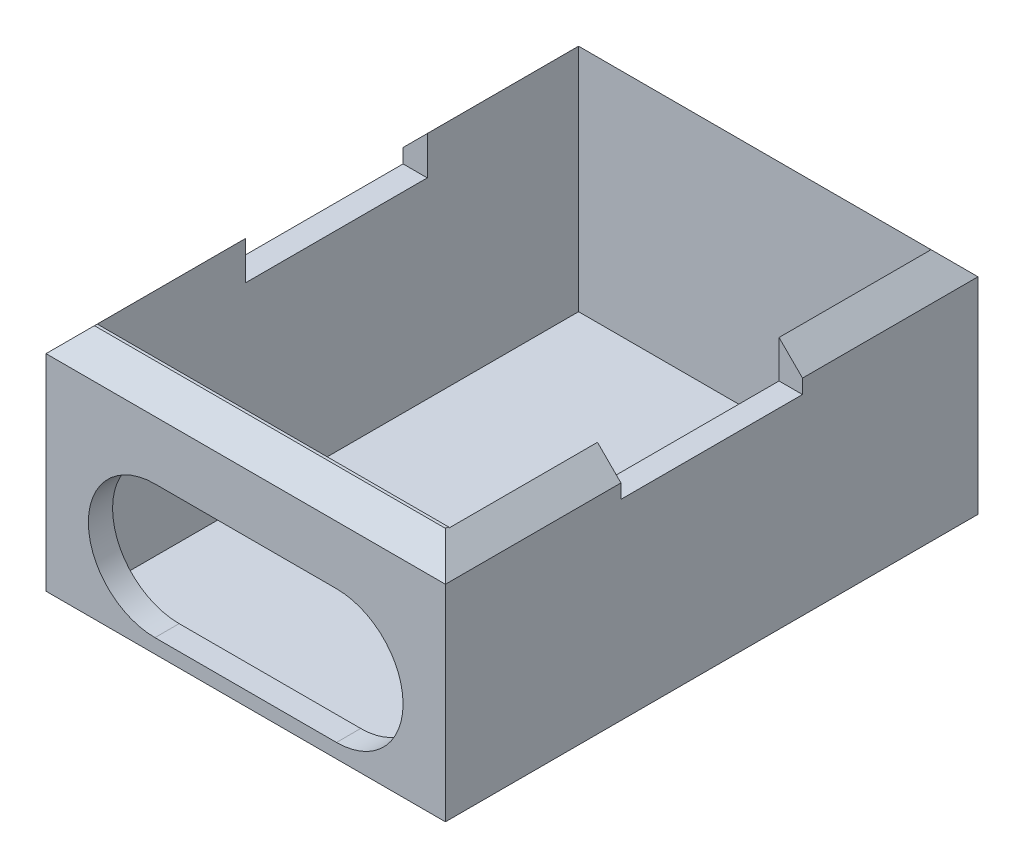
from build123d import *

# Parameters (mm, degrees)
SKETCH1_W           = 33
SKETCH1_H           = 44
BOSS_EXTRUDE1_DEPTH = 21
SHELL1_START        = 2
SHELL1_OUTLINE_W    = 17
SHELL1_OUTLINE_H    = 40
SHELL1_DEPTH        = 29
SKETCH2_W           = 29.062005015
SKETCH2_H           = 39.767253615
CUT_EXTRUDE1_DEPTH  = 7
CUT_EXTRUDE2_DEPTH  = 7
SKETCH4_W           = 15
SKETCH4_H           = 3.175
CUT_EXTRUDE3_DEPTH  = 45
CHAMFER1_SIZE       = 2


# Read off the part's stored shape, not the designer's step: Shell1
with BuildPart() as part:
    # Sketch1 → Boss-Extrude1 (new body)
    with BuildSketch(Plane(origin=(0, 0, 0), x_dir=(1, 0, 0), z_dir=(0, 1, 0))):
        with Locations((16.5, -12.899591929)):
            Rectangle(SKETCH1_W, SKETCH1_H)
    extrude(amount=BOSS_EXTRUDE1_DEPTH)

    # Shell1 outline → Shell1 (cut)
    with BuildSketch(Plane.YZ.offset(SHELL1_START)):
        with Locations((10.5, 12.899591929)):
            Rectangle(SHELL1_OUTLINE_W, SHELL1_OUTLINE_H)
    extrude(amount=SHELL1_DEPTH, mode=Mode.SUBTRACT)

    # Sketch2 → Cut-Extrude1 (cut)
    with BuildSketch(Plane(origin=(0, 21, 0), x_dir=(1, 0, 0), z_dir=(0, 1, 0))):
        with Locations((16.531002507, -12.783218737)):
            Rectangle(SKETCH2_W, SKETCH2_H)
    extrude(amount=-CUT_EXTRUDE1_DEPTH, mode=Mode.SUBTRACT)

    # Sketch3 → Cut-Extrude2 (cut)
    with BuildSketch(Plane.XY.offset(34.899591929)):
        with BuildLine():
            ThreePointArc((14.5, 8.681065769), (12.889087297, 12.570153065), (9, 14.181065769))
            Line((9, 14.181065769), (9, 3.181065769))
            ThreePointArc((9, 3.181065769), (12.889087297, 4.791978472), (14.5, 8.681065769))
        make_face()
        with BuildLine():
            Line((9, 3.181065769), (9, 14.181065769))
            ThreePointArc((9, 14.181065769), (3.5, 8.681065769), (9, 3.181065769))
        make_face()
        with BuildLine():
            Line((16.5, 3.181065769), (16.5, 14.181065769))
            Line((16.5, 14.181065769), (9, 14.181065769))
            ThreePointArc((9, 14.181065769), (12.889087297, 12.570153065), (14.5, 8.681065769))
            ThreePointArc((14.5, 8.681065769), (12.889087297, 4.791978472), (9, 3.181065769))
            Line((9, 3.181065769), (16.5, 3.181065769))
        make_face()
        with BuildLine():
            ThreePointArc((24, 3.181065769), (18.5, 8.681065769), (24, 14.181065769))
            Line((24, 14.181065769), (16.5, 14.181065769))
            Line((16.5, 14.181065769), (16.5, 3.181065769))
            Line((16.5, 3.181065769), (24, 3.181065769))
        make_face()
        with BuildLine():
            ThreePointArc((29.5, 8.681065769), (27.889087297, 12.570153065), (24, 14.181065769))
            Line((24, 14.181065769), (24, 3.181065769))
            ThreePointArc((24, 3.181065769), (27.889087297, 4.791978472), (29.5, 8.681065769))
        make_face()
        with BuildLine():
            Line((24, 3.181065769), (24, 14.181065769))
            ThreePointArc((24, 14.181065769), (18.5, 8.681065769), (24, 3.181065769))
        make_face()
    extrude(amount=-CUT_EXTRUDE2_DEPTH, mode=Mode.SUBTRACT)

    # Sketch4 → Cut-Extrude3 (cut)
    with BuildSketch(Plane(origin=(33, 0, 0), x_dir=(0, 0, -1), z_dir=(1, 0, 0))):
        with Locations((-12.899591929, 19.4125)):
            Rectangle(SKETCH4_W, SKETCH4_H)
    extrude(amount=-CUT_EXTRUDE3_DEPTH, mode=Mode.SUBTRACT)

    # Chamfer1
    chamfer1_edges = [part.edges().sort_by_distance(p)[0] for p in [
        (16.5, 0, 34.899591929),
        (33, 0, 12.899591929),
        (16.5, 0, -9.100408071),
        (0, 0, 12.899591929),
        (33, 21, -1.850408071),
        (16.5, 21, -9.100408071),
        (0, 21, -1.850408071),
        (0, 21, 27.649591929),
        (16.5, 21, 34.899591929),
        (33, 21, 27.649591929),
    ]]
    chamfer(chamfer1_edges, length=CHAMFER1_SIZE - 0.0001)  # a hair under: the kernel refuses the full size


solid = part.part
